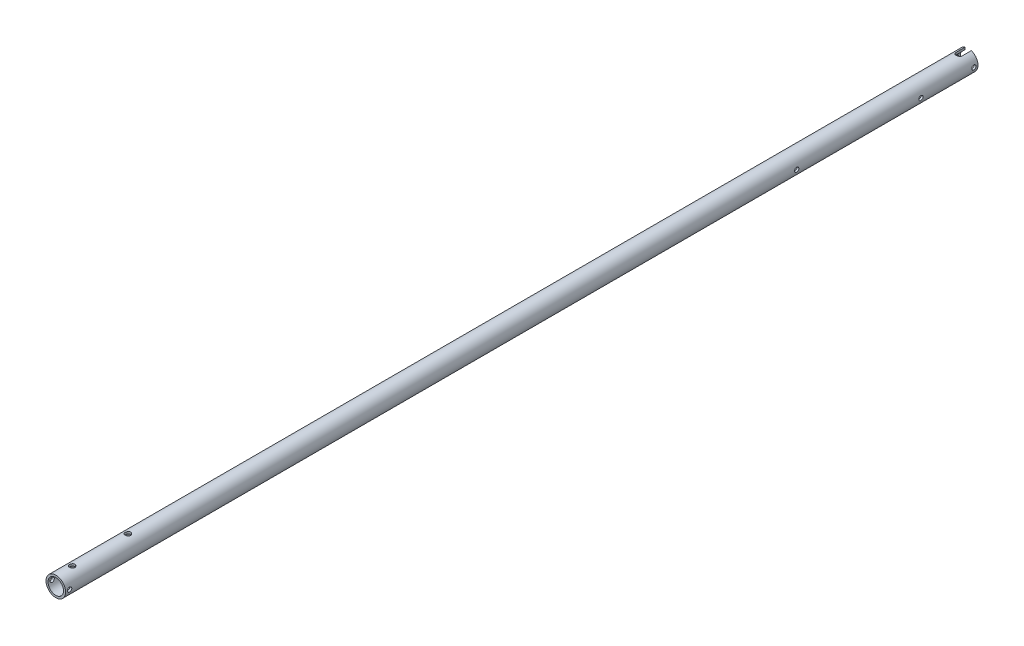
from build123d import *

# Parameters (mm, degrees)
SKETCH1_R                = 15.24
SKETCH1_R_2              = 12.065
BOSS_EXTRUDE1_DEPTH      = 1422.4
F_5_16_CLEARANCE_HOLE1_D = 8.4328
F_1_4_CLEARANCE_HOLE3_D  = 6.7564
CUT_EXTRUDE1_DEPTH       = 1423.808155829


with BuildPart() as part:
    # Sketch1 → Boss-Extrude1 (new body)
    with BuildSketch(Plane.XY):
        Circle(SKETCH1_R)
        Circle(SKETCH1_R_2, mode=Mode.SUBTRACT)
    extrude(amount=BOSS_EXTRUDE1_DEPTH)

    # 5/16 Clearance Hole1 (through all)
    with Locations(Plane(origin=(0, -15.24, 0), x_dir=(-1, 0, 0), z_dir=(0, -1, 0))):
        with Locations((0, -1397), (0, -1310.132)):
            Hole(F_5_16_CLEARANCE_HOLE1_D / 2)

    # 1/4 Clearance Hole3 (through all)
    with Locations(Plane.ZY.offset(15.24)):
        with Locations((88.9, 0), (282.575, 0), (6.35, 0), (1416.05, 0)):
            Hole(F_1_4_CLEARANCE_HOLE3_D / 2)

    # Sketch12 → Cut-Extrude1 (cut, through all)
    with BuildSketch(Plane(origin=(0, -15.24, 0), x_dir=(-1, 0, 0), z_dir=(0, -1, 0))):
        with BuildLine():
            Line((0, 0), (4.7625, 0))
            Line((4.7625, 0), (4.7625, -14.2875))
            ThreePointArc((4.7625, -14.2875), (0, -19.05), (-4.7625, -14.2875))
            Line((-4.7625, -14.2875), (-4.7625, 0))
            Line((-4.7625, 0), (0, 0))
        make_face()
    extrude(amount=-CUT_EXTRUDE1_DEPTH, mode=Mode.SUBTRACT)


solid = part.part
